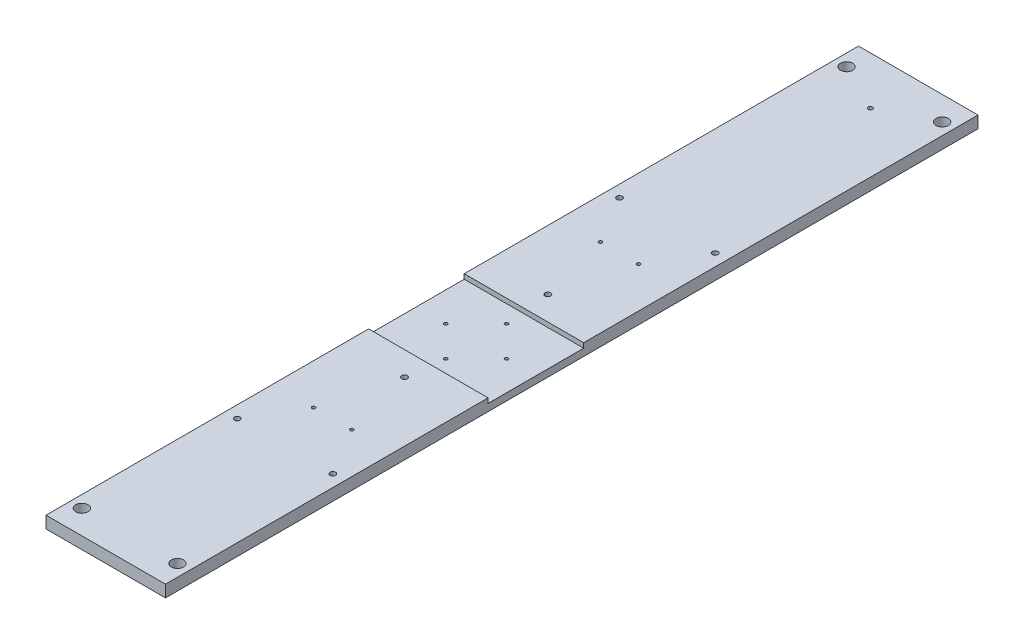
from build123d import *

# Parameters (mm, degrees)
SKETCH1_W           = 63.5
SKETCH1_H           = 431.8
BOSS_EXTRUDE1_DEPTH = 6.35
SKETCH6_R           = 3.2639
CUT_EXTRUDE9_DEPTH  = 437.490334945
SKETCH7_R           = 1.4732
CUT_EXTRUDE10_DEPTH = 437.490334945
SKETCH8_R           = 0.889
CUT_EXTRUDE11_DEPTH = 437.490334945
SKETCH9_W           = 63.5
SKETCH9_H           = 50.8
CUT_EXTRUDE12_DEPTH = 2.54
SKETCH10_R          = 1.1303
CUT_EXTRUDE13_DEPTH = 437.490334945


with BuildPart() as part:
    # Sketch1 → Boss-Extrude1 (new body)
    with BuildSketch(Plane(origin=(0, 0, 0), x_dir=(1, 0, 0), z_dir=(0, 1, 0))):
        with Locations((31.75, 215.9)):
            Rectangle(SKETCH1_W, SKETCH1_H)
    extrude(amount=BOSS_EXTRUDE1_DEPTH)

    # Sketch6 → Cut-Extrude9 (cut, through all)
    with BuildSketch(Plane(origin=(0, 6.35, 0), x_dir=(1, 0, 0), z_dir=(0, 1, 0))):
        with Locations((6.35, 419.1)):
            Circle(SKETCH6_R)
        with Locations((57.15, 419.1)):
            Circle(SKETCH6_R)
        with Locations((57.15, 12.7)):
            Circle(SKETCH6_R)
        with Locations((6.35, 12.7)):
            Circle(SKETCH6_R)
    extrude(amount=-CUT_EXTRUDE9_DEPTH, mode=Mode.SUBTRACT)

    # Sketch7 → Cut-Extrude10 (cut, through all)
    with BuildSketch(Plane(origin=(0, 6.35, 0), x_dir=(1, 0, 0), z_dir=(0, 1, 0))):
        with Locations((6.35, 298.45)):
            Circle(SKETCH7_R)
        with Locations((57.15, 298.45)):
            Circle(SKETCH7_R)
        with Locations((57.15, 95.25)):
            Circle(SKETCH7_R)
        with Locations((6.35, 95.25)):
            Circle(SKETCH7_R)
        with Locations((31.75, 234.95)):
            Circle(SKETCH7_R)
        with Locations((31.75, 158.75)):
            Circle(SKETCH7_R)
    extrude(amount=-CUT_EXTRUDE10_DEPTH, mode=Mode.SUBTRACT)

    # Sketch8 → Cut-Extrude11 (cut, through all)
    with BuildSketch(Plane(origin=(0, 6.35, 0), x_dir=(1, 0, 0), z_dir=(0, 1, 0))):
        with Locations((15.58544, 196.85)):
            Circle(SKETCH8_R)
        with Locations((31.75, 213.01456)):
            Circle(SKETCH8_R)
        with Locations((47.91456, 196.85)):
            Circle(SKETCH8_R)
        with Locations((31.75, 180.68544)):
            Circle(SKETCH8_R)
        with Locations((21.59, 273.05)):
            Circle(SKETCH8_R)
        with Locations((41.91, 273.05)):
            Circle(SKETCH8_R)
        with Locations((41.91, 120.65)):
            Circle(SKETCH8_R)
        with Locations((21.59, 120.65)):
            Circle(SKETCH8_R)
    extrude(amount=-CUT_EXTRUDE11_DEPTH, mode=Mode.SUBTRACT)

    # Sketch9 → Cut-Extrude12 (cut)
    with BuildSketch(Plane(origin=(0, 6.35, 0), x_dir=(1, 0, 0), z_dir=(0, 1, 0))):
        with Locations((31.75, 196.85)):
            Rectangle(SKETCH9_W, SKETCH9_H)
    extrude(amount=-CUT_EXTRUDE12_DEPTH, mode=Mode.SUBTRACT)

    # Sketch10 → Cut-Extrude13 (cut, through all)
    with BuildSketch(Plane(origin=(0, 6.35, 0), x_dir=(1, 0, 0), z_dir=(0, 1, 0))):
        with Locations((31.75, 406.4)):
            Circle(SKETCH10_R)
    extrude(amount=-CUT_EXTRUDE13_DEPTH, mode=Mode.SUBTRACT)


solid = part.part
